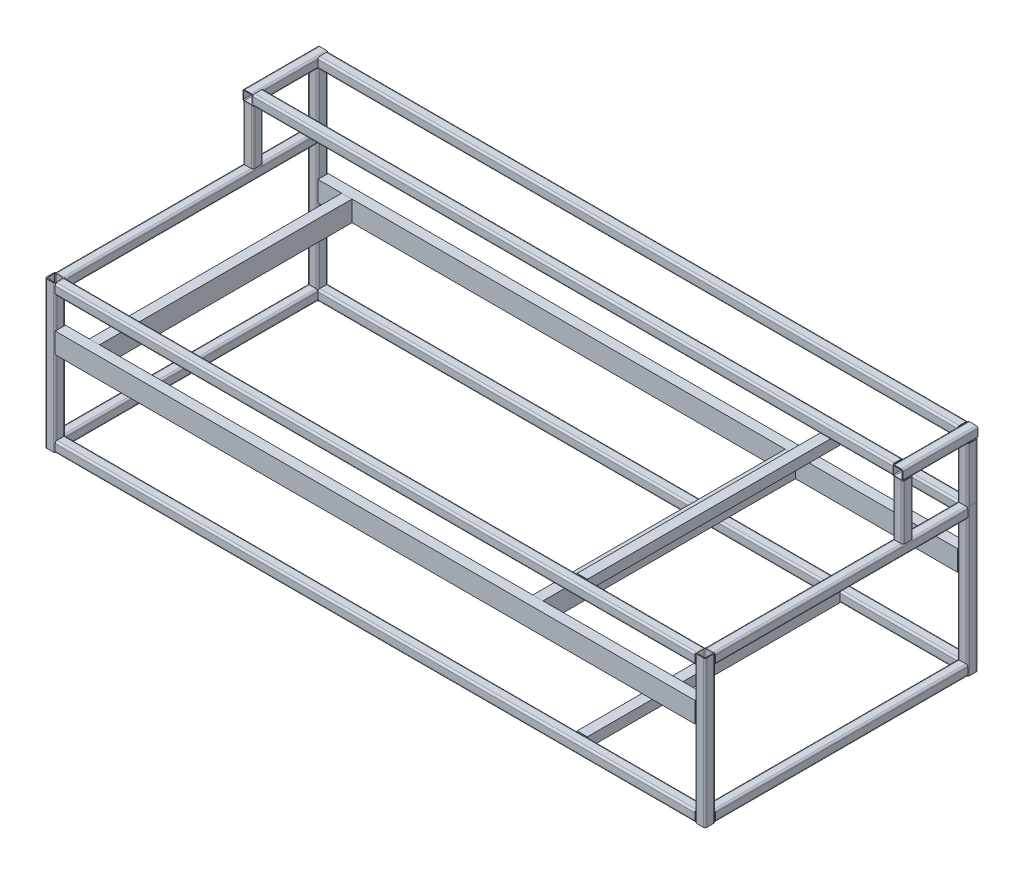
from build123d import *

# Parameters (mm, degrees)
STRUCTURAL_START                = 15
STRUCTURAL_MEMBER2_DEPTH        = 1875
STRUCTURAL_START_2              = -755
STRUCTURAL_MEMBER2_2_DEPTH      = 740
STRUCTURAL_START_3              = -15
STRUCTURAL_MEMBER2_3_DEPTH      = 430
BOSS_EXTRUDE1_REACH             = 1315.205
SKETCH2_W                       = 30
SKETCH2_H                       = 60
BOSS_EXTRUDE1_DIRECTION_2_REACH = 1315.205
BOSS_EXTRUDE2_START             = -30
SKETCH3_W                       = 30
SKETCH3_H                       = 60
BOSS_EXTRUDE2_DEPTH             = 740
BOSS_EXTRUDE2_2_DEPTH           = 740
BOSS_EXTRUDE3_DEPTH             = 160
BOSS_EXTRUDE3_2_DEPTH           = 160
LPATTERN1_COUNT                 = 2
LPATTERN1_PITCH                 = 190
STRUCTURAL_MEMBER3_DEPTH        = 1875
STRUCTURAL_START_4              = -785
STRUCTURAL_MEMBER3_2_DEPTH      = 220
SKETCH14_W                      = 30
SKETCH14_H                      = 30
BOSS_EXTRUDE4_DEPTH             = 740
BOSS_EXTRUDE4_2_DEPTH           = 740


# Read off the part's stored shape, not the designer's step: Structural Member2, Structural Member3
with BuildPart() as part:
    # Structural Member2 outline → Structural Member2 (new body)
    # profile 1 of 4: a face of its own
    with BuildSketch(Plane.YZ.offset(STRUCTURAL_START)):
        with BuildLine():
            Line((409.8, -755), (390.2, -755))
            ThreePointArc((390.2, -755), (386.523044738, -756.523044738), (385, -760.2))
            Line((385, -760.2), (385, -779.8))
            ThreePointArc((385, -779.8), (386.523044738, -783.476955262), (390.2, -785))
            Line((390.2, -785), (409.8, -785))
            ThreePointArc((409.8, -785), (413.476955262, -783.476955262), (415, -779.8))
            Line((415, -779.8), (415, -760.2))
            ThreePointArc((415, -760.2), (413.476955262, -756.523044738), (409.8, -755))
        make_face()
        with BuildLine():
            ThreePointArc((412.4, -779.8), (411.638477631, -781.638477631), (409.8, -782.4))
            Line((409.8, -782.4), (390.2, -782.4))
            ThreePointArc((390.2, -782.4), (388.361522369, -781.638477631), (387.6, -779.8))
            Line((387.6, -779.8), (387.6, -760.2))
            ThreePointArc((387.6, -760.2), (388.361522369, -758.361522369), (390.2, -757.6))
            Line((390.2, -757.6), (409.8, -757.6))
            ThreePointArc((409.8, -757.6), (411.638477631, -758.361522369), (412.4, -760.2))
            Line((412.4, -760.2), (412.4, -779.8))
        make_face(mode=Mode.SUBTRACT)
    # profile 2 of 4: a face of its own
    with BuildSketch(Plane.YZ.offset(STRUCTURAL_START)):
        with BuildLine():
            Line((409.8, 15), (390.2, 15))
            ThreePointArc((390.2, 15), (386.523044738, 13.476955262), (385, 9.8))
            Line((385, 9.8), (385, -9.8))
            ThreePointArc((385, -9.8), (386.523044738, -13.476955262), (390.2, -15))
            Line((390.2, -15), (409.8, -15))
            ThreePointArc((409.8, -15), (413.476955262, -13.476955262), (415, -9.8))
            Line((415, -9.8), (415, 9.8))
            ThreePointArc((415, 9.8), (413.476955262, 13.476955262), (409.8, 15))
        make_face()
        with BuildLine():
            ThreePointArc((412.4, -9.8), (411.638477631, -11.638477631), (409.8, -12.4))
            Line((409.8, -12.4), (390.2, -12.4))
            ThreePointArc((390.2, -12.4), (388.361522369, -11.638477631), (387.6, -9.8))
            Line((387.6, -9.8), (387.6, 9.8))
            ThreePointArc((387.6, 9.8), (388.361522369, 11.638477631), (390.2, 12.4))
            Line((390.2, 12.4), (409.8, 12.4))
            ThreePointArc((409.8, 12.4), (411.638477631, 11.638477631), (412.4, 9.8))
            Line((412.4, 9.8), (412.4, -9.8))
        make_face(mode=Mode.SUBTRACT)
    # profile 3 of 4: a face of its own
    with BuildSketch(Plane.YZ.offset(STRUCTURAL_START)):
        with BuildLine():
            Line((9.8, 15), (-9.8, 15))
            ThreePointArc((-9.8, 15), (-13.476955262, 13.476955262), (-15, 9.8))
            Line((-15, 9.8), (-15, -9.8))
            ThreePointArc((-15, -9.8), (-13.476955262, -13.476955262), (-9.8, -15))
            Line((-9.8, -15), (9.8, -15))
            ThreePointArc((9.8, -15), (13.476955262, -13.476955262), (15, -9.8))
            Line((15, -9.8), (15, 9.8))
            ThreePointArc((15, 9.8), (13.476955262, 13.476955262), (9.8, 15))
        make_face()
        with BuildLine():
            ThreePointArc((12.4, -9.8), (11.638477631, -11.638477631), (9.8, -12.4))
            Line((9.8, -12.4), (-9.8, -12.4))
            ThreePointArc((-9.8, -12.4), (-11.638477631, -11.638477631), (-12.4, -9.8))
            Line((-12.4, -9.8), (-12.4, 9.8))
            ThreePointArc((-12.4, 9.8), (-11.638477631, 11.638477631), (-9.8, 12.4))
            Line((-9.8, 12.4), (9.8, 12.4))
            ThreePointArc((9.8, 12.4), (11.638477631, 11.638477631), (12.4, 9.8))
            Line((12.4, 9.8), (12.4, -9.8))
        make_face(mode=Mode.SUBTRACT)
    # profile 4 of 4: a face of its own
    with BuildSketch(Plane.YZ.offset(STRUCTURAL_START)):
        with BuildLine():
            Line((9.8, -755), (-9.8, -755))
            ThreePointArc((-9.8, -755), (-13.476955262, -756.523044738), (-15, -760.2))
            Line((-15, -760.2), (-15, -779.8))
            ThreePointArc((-15, -779.8), (-13.476955262, -783.476955262), (-9.8, -785))
            Line((-9.8, -785), (9.8, -785))
            ThreePointArc((9.8, -785), (13.476955262, -783.476955262), (15, -779.8))
            Line((15, -779.8), (15, -760.2))
            ThreePointArc((15, -760.2), (13.476955262, -756.523044738), (9.8, -755))
        make_face()
        with BuildLine():
            ThreePointArc((12.4, -779.8), (11.638477631, -781.638477631), (9.8, -782.4))
            Line((9.8, -782.4), (-9.8, -782.4))
            ThreePointArc((-9.8, -782.4), (-11.638477631, -781.638477631), (-12.4, -779.8))
            Line((-12.4, -779.8), (-12.4, -760.2))
            ThreePointArc((-12.4, -760.2), (-11.638477631, -758.361522369), (-9.8, -757.6))
            Line((-9.8, -757.6), (9.8, -757.6))
            ThreePointArc((9.8, -757.6), (11.638477631, -758.361522369), (12.4, -760.2))
            Line((12.4, -760.2), (12.4, -779.8))
        make_face(mode=Mode.SUBTRACT)
    extrude(amount=STRUCTURAL_MEMBER2_DEPTH)


with BuildPart() as body_2:
    # Structural Member2 2 outline → Structural Member2 2 (new body)
    # profile 1 of 4: a face of its own
    with BuildSketch(Plane.XY.offset(STRUCTURAL_START_2)):
        with BuildLine():
            ThreePointArc((1920, 409.8), (1918.476955262, 413.476955262), (1914.8, 415))
            Line((1914.8, 415), (1895.2, 415))
            ThreePointArc((1895.2, 415), (1891.523044738, 413.476955262), (1890, 409.8))
            Line((1890, 409.8), (1890, 390.2))
            ThreePointArc((1890, 390.2), (1891.523044738, 386.523044738), (1895.2, 385))
            Line((1895.2, 385), (1914.8, 385))
            ThreePointArc((1914.8, 385), (1918.476955262, 386.523044738), (1920, 390.2))
            Line((1920, 390.2), (1920, 409.8))
        make_face()
        with BuildLine():
            Line((1892.6, 390.2), (1892.6, 409.8))
            ThreePointArc((1892.6, 409.8), (1893.361522369, 411.638477631), (1895.2, 412.4))
            Line((1895.2, 412.4), (1914.8, 412.4))
            ThreePointArc((1914.8, 412.4), (1916.638477631, 411.638477631), (1917.4, 409.8))
            Line((1917.4, 409.8), (1917.4, 390.2))
            ThreePointArc((1917.4, 390.2), (1916.638477631, 388.361522369), (1914.8, 387.6))
            Line((1914.8, 387.6), (1895.2, 387.6))
            ThreePointArc((1895.2, 387.6), (1893.361522369, 388.361522369), (1892.6, 390.2))
        make_face(mode=Mode.SUBTRACT)
    # profile 2 of 4: a face of its own
    with BuildSketch(Plane.XY.offset(STRUCTURAL_START_2)):
        with BuildLine():
            Line((1895.2, -15), (1914.8, -15))
            ThreePointArc((1914.8, -15), (1918.476955262, -13.476955262), (1920, -9.8))
            Line((1920, -9.8), (1920, 9.8))
            ThreePointArc((1920, 9.8), (1918.476955262, 13.476955262), (1914.8, 15))
            Line((1914.8, 15), (1895.2, 15))
            ThreePointArc((1895.2, 15), (1891.523044738, 13.476955262), (1890, 9.8))
            Line((1890, 9.8), (1890, -9.8))
            ThreePointArc((1890, -9.8), (1891.523044738, -13.476955262), (1895.2, -15))
        make_face()
        with BuildLine():
            ThreePointArc((1895.2, -12.4), (1893.361522369, -11.638477631), (1892.6, -9.8))
            Line((1892.6, -9.8), (1892.6, 9.8))
            ThreePointArc((1892.6, 9.8), (1893.361522369, 11.638477631), (1895.2, 12.4))
            Line((1895.2, 12.4), (1914.8, 12.4))
            ThreePointArc((1914.8, 12.4), (1916.638477631, 11.638477631), (1917.4, 9.8))
            Line((1917.4, 9.8), (1917.4, -9.8))
            ThreePointArc((1917.4, -9.8), (1916.638477631, -11.638477631), (1914.8, -12.4))
            Line((1914.8, -12.4), (1895.2, -12.4))
        make_face(mode=Mode.SUBTRACT)
    # profile 3 of 4: a face of its own
    with BuildSketch(Plane.XY.offset(STRUCTURAL_START_2)):
        with BuildLine():
            ThreePointArc((15, 409.8), (13.476955262, 413.476955262), (9.8, 415))
            Line((9.8, 415), (-9.8, 415))
            ThreePointArc((-9.8, 415), (-13.476955262, 413.476955262), (-15, 409.8))
            Line((-15, 409.8), (-15, 390.2))
            ThreePointArc((-15, 390.2), (-13.476955262, 386.523044738), (-9.8, 385))
            Line((-9.8, 385), (9.8, 385))
            ThreePointArc((9.8, 385), (13.476955262, 386.523044738), (15, 390.2))
            Line((15, 390.2), (15, 409.8))
        make_face()
        with BuildLine():
            Line((-12.4, 390.2), (-12.4, 409.8))
            ThreePointArc((-12.4, 409.8), (-11.638477631, 411.638477631), (-9.8, 412.4))
            Line((-9.8, 412.4), (9.8, 412.4))
            ThreePointArc((9.8, 412.4), (11.638477631, 411.638477631), (12.4, 409.8))
            Line((12.4, 409.8), (12.4, 390.2))
            ThreePointArc((12.4, 390.2), (11.638477631, 388.361522369), (9.8, 387.6))
            Line((9.8, 387.6), (-9.8, 387.6))
            ThreePointArc((-9.8, 387.6), (-11.638477631, 388.361522369), (-12.4, 390.2))
        make_face(mode=Mode.SUBTRACT)
    # profile 4 of 4: a face of its own
    with BuildSketch(Plane.XY.offset(STRUCTURAL_START_2)):
        with BuildLine():
            Line((-9.8, -15), (9.8, -15))
            ThreePointArc((9.8, -15), (13.476955262, -13.476955262), (15, -9.8))
            Line((15, -9.8), (15, 9.8))
            ThreePointArc((15, 9.8), (13.476955262, 13.476955262), (9.8, 15))
            Line((9.8, 15), (-9.8, 15))
            ThreePointArc((-9.8, 15), (-13.476955262, 13.476955262), (-15, 9.8))
            Line((-15, 9.8), (-15, -9.8))
            ThreePointArc((-15, -9.8), (-13.476955262, -13.476955262), (-9.8, -15))
        make_face()
        with BuildLine():
            ThreePointArc((-9.8, -12.4), (-11.638477631, -11.638477631), (-12.4, -9.8))
            Line((-12.4, -9.8), (-12.4, 9.8))
            ThreePointArc((-12.4, 9.8), (-11.638477631, 11.638477631), (-9.8, 12.4))
            Line((-9.8, 12.4), (9.8, 12.4))
            ThreePointArc((9.8, 12.4), (11.638477631, 11.638477631), (12.4, 9.8))
            Line((12.4, 9.8), (12.4, -9.8))
            ThreePointArc((12.4, -9.8), (11.638477631, -11.638477631), (9.8, -12.4))
            Line((9.8, -12.4), (-9.8, -12.4))
        make_face(mode=Mode.SUBTRACT)
    extrude(amount=STRUCTURAL_MEMBER2_2_DEPTH)


with BuildPart() as body_3:
    # Structural Member2 3 outline → Structural Member2 3 (new body)
    # profile 1 of 4: a face of its own
    with BuildSketch(Plane(origin=(0, 0, 0), x_dir=(1, 0, 0), z_dir=(0, 1, 0)).offset(STRUCTURAL_START_3)):
        with BuildLine():
            ThreePointArc((1920, 779.8), (1918.476955262, 783.476955262), (1914.8, 785))
            Line((1914.8, 785), (1895.2, 785))
            ThreePointArc((1895.2, 785), (1891.523044738, 783.476955262), (1890, 779.8))
            Line((1890, 779.8), (1890, 760.2))
            ThreePointArc((1890, 760.2), (1891.523044738, 756.523044738), (1895.2, 755))
            Line((1895.2, 755), (1914.8, 755))
            ThreePointArc((1914.8, 755), (1918.476955262, 756.523044738), (1920, 760.2))
            Line((1920, 760.2), (1920, 779.8))
        make_face()
        with BuildLine():
            Line((1892.6, 760.2), (1892.6, 779.8))
            ThreePointArc((1892.6, 779.8), (1893.361522369, 781.638477631), (1895.2, 782.4))
            Line((1895.2, 782.4), (1914.8, 782.4))
            ThreePointArc((1914.8, 782.4), (1916.638477631, 781.638477631), (1917.4, 779.8))
            Line((1917.4, 779.8), (1917.4, 760.2))
            ThreePointArc((1917.4, 760.2), (1916.638477631, 758.361522369), (1914.8, 757.6))
            Line((1914.8, 757.6), (1895.2, 757.6))
            ThreePointArc((1895.2, 757.6), (1893.361522369, 758.361522369), (1892.6, 760.2))
        make_face(mode=Mode.SUBTRACT)
    # profile 2 of 4: a face of its own
    with BuildSketch(Plane(origin=(0, 0, 0), x_dir=(1, 0, 0), z_dir=(0, 1, 0)).offset(STRUCTURAL_START_3)):
        with BuildLine():
            Line((1895.2, -15), (1914.8, -15))
            ThreePointArc((1914.8, -15), (1918.476955262, -13.476955262), (1920, -9.8))
            Line((1920, -9.8), (1920, 9.8))
            ThreePointArc((1920, 9.8), (1918.476955262, 13.476955262), (1914.8, 15))
            Line((1914.8, 15), (1895.2, 15))
            ThreePointArc((1895.2, 15), (1891.523044738, 13.476955262), (1890, 9.8))
            Line((1890, 9.8), (1890, -9.8))
            ThreePointArc((1890, -9.8), (1891.523044738, -13.476955262), (1895.2, -15))
        make_face()
        with BuildLine():
            ThreePointArc((1895.2, -12.4), (1893.361522369, -11.638477631), (1892.6, -9.8))
            Line((1892.6, -9.8), (1892.6, 9.8))
            ThreePointArc((1892.6, 9.8), (1893.361522369, 11.638477631), (1895.2, 12.4))
            Line((1895.2, 12.4), (1914.8, 12.4))
            ThreePointArc((1914.8, 12.4), (1916.638477631, 11.638477631), (1917.4, 9.8))
            Line((1917.4, 9.8), (1917.4, -9.8))
            ThreePointArc((1917.4, -9.8), (1916.638477631, -11.638477631), (1914.8, -12.4))
            Line((1914.8, -12.4), (1895.2, -12.4))
        make_face(mode=Mode.SUBTRACT)
    # profile 3 of 4: a face of its own
    with BuildSketch(Plane(origin=(0, 0, 0), x_dir=(1, 0, 0), z_dir=(0, 1, 0)).offset(STRUCTURAL_START_3)):
        with BuildLine():
            ThreePointArc((15, 779.8), (13.476955262, 783.476955262), (9.8, 785))
            Line((9.8, 785), (-9.8, 785))
            ThreePointArc((-9.8, 785), (-13.476955262, 783.476955262), (-15, 779.8))
            Line((-15, 779.8), (-15, 760.2))
            ThreePointArc((-15, 760.2), (-13.476955262, 756.523044738), (-9.8, 755))
            Line((-9.8, 755), (9.8, 755))
            ThreePointArc((9.8, 755), (13.476955262, 756.523044738), (15, 760.2))
            Line((15, 760.2), (15, 779.8))
        make_face()
        with BuildLine():
            Line((-12.4, 760.2), (-12.4, 779.8))
            ThreePointArc((-12.4, 779.8), (-11.638477631, 781.638477631), (-9.8, 782.4))
            Line((-9.8, 782.4), (9.8, 782.4))
            ThreePointArc((9.8, 782.4), (11.638477631, 781.638477631), (12.4, 779.8))
            Line((12.4, 779.8), (12.4, 760.2))
            ThreePointArc((12.4, 760.2), (11.638477631, 758.361522369), (9.8, 757.6))
            Line((9.8, 757.6), (-9.8, 757.6))
            ThreePointArc((-9.8, 757.6), (-11.638477631, 758.361522369), (-12.4, 760.2))
        make_face(mode=Mode.SUBTRACT)
    # profile 4 of 4: a face of its own
    with BuildSketch(Plane(origin=(0, 0, 0), x_dir=(1, 0, 0), z_dir=(0, 1, 0)).offset(STRUCTURAL_START_3)):
        with BuildLine():
            Line((-9.8, -15), (9.8, -15))
            ThreePointArc((9.8, -15), (13.476955262, -13.476955262), (15, -9.8))
            Line((15, -9.8), (15, 9.8))
            ThreePointArc((15, 9.8), (13.476955262, 13.476955262), (9.8, 15))
            Line((9.8, 15), (-9.8, 15))
            ThreePointArc((-9.8, 15), (-13.476955262, 13.476955262), (-15, 9.8))
            Line((-15, 9.8), (-15, -9.8))
            ThreePointArc((-15, -9.8), (-13.476955262, -13.476955262), (-9.8, -15))
        make_face()
        with BuildLine():
            ThreePointArc((-9.8, -12.4), (-11.638477631, -11.638477631), (-12.4, -9.8))
            Line((-12.4, -9.8), (-12.4, 9.8))
            ThreePointArc((-12.4, 9.8), (-11.638477631, 11.638477631), (-9.8, 12.4))
            Line((-9.8, 12.4), (9.8, 12.4))
            ThreePointArc((9.8, 12.4), (11.638477631, 11.638477631), (12.4, 9.8))
            Line((12.4, 9.8), (12.4, -9.8))
            ThreePointArc((12.4, -9.8), (11.638477631, -11.638477631), (9.8, -12.4))
            Line((9.8, -12.4), (-9.8, -12.4))
        make_face(mode=Mode.SUBTRACT)
    extrude(amount=STRUCTURAL_MEMBER2_3_DEPTH)


with BuildPart() as body_4:

    # Boss-Extrude1: up to this face of the body (flat: up to its plane)
    boss_extrude1_end = Plane(body_3.part.faces().sort_by_distance((15, 200, -770))[0])
    # Sketch2 → Boss-Extrude1 (new, up to the picked face)
    with BuildSketch(Plane(origin=(952.5, 0, 0), x_dir=(0, 0, -1), z_dir=(1, 0, 0)), mode=Mode.PRIVATE) as boss_extrude1_sk1:
        with Locations((770, 265)):
            Rectangle(SKETCH2_W, SKETCH2_H)
    boss_extrude1_tool1 = split(extrude(boss_extrude1_sk1.sketch, amount=-BOSS_EXTRUDE1_REACH, mode=Mode.PRIVATE), bisect_by=boss_extrude1_end, keep=Keep.BOTH, mode=Mode.PRIVATE)
    # Sketch2 → Boss-Extrude1 (new, up to the picked face)
    with BuildSketch(Plane(origin=(952.5, 0, 0), x_dir=(0, 0, -1), z_dir=(1, 0, 0)), mode=Mode.PRIVATE) as boss_extrude1_sk2:
        with Locations((0, 265)):
            Rectangle(SKETCH2_W, SKETCH2_H)
    boss_extrude1_tool2 = split(extrude(boss_extrude1_sk2.sketch, amount=-BOSS_EXTRUDE1_REACH, mode=Mode.PRIVATE), bisect_by=boss_extrude1_end, keep=Keep.BOTH, mode=Mode.PRIVATE)
    add(boss_extrude1_tool1.solids().sort_by(Axis((952.5, 265, -770), (-1, 0, 0)))[0])
    add(boss_extrude1_tool2.solids().sort_by(Axis((952.5, 265, 0), (-1, 0, 0)))[0])


    # Boss-Extrude1 direction 2: up to this face of the body (flat: up to its plane)
    boss_extrude1_direction_2_end = Plane(body_3.part.faces().sort_by_distance((1890, 200, -770))[0])
    # Sketch2 → Boss-Extrude1 direction 2 (add, up to the picked face)
    with BuildSketch(Plane(origin=(952.5, 0, 0), x_dir=(0, 0, -1), z_dir=(1, 0, 0)), mode=Mode.PRIVATE) as boss_extrude1_direction_2_sk1:
        with Locations((770, 265)):
            Rectangle(SKETCH2_W, SKETCH2_H)
    boss_extrude1_direction_2_tool1 = split(extrude(boss_extrude1_direction_2_sk1.sketch, amount=BOSS_EXTRUDE1_DIRECTION_2_REACH, mode=Mode.PRIVATE), bisect_by=boss_extrude1_direction_2_end, keep=Keep.BOTH, mode=Mode.PRIVATE)
    # Sketch2 → Boss-Extrude1 direction 2 (add, up to the picked face)
    with BuildSketch(Plane(origin=(952.5, 0, 0), x_dir=(0, 0, -1), z_dir=(1, 0, 0)), mode=Mode.PRIVATE) as boss_extrude1_direction_2_sk2:
        with Locations((0, 265)):
            Rectangle(SKETCH2_W, SKETCH2_H)
    boss_extrude1_direction_2_tool2 = split(extrude(boss_extrude1_direction_2_sk2.sketch, amount=BOSS_EXTRUDE1_DIRECTION_2_REACH, mode=Mode.PRIVATE), bisect_by=boss_extrude1_direction_2_end, keep=Keep.BOTH, mode=Mode.PRIVATE)
    add(boss_extrude1_direction_2_tool1.solids().sort_by(Axis((952.5, 265, -770), (1, 0, 0)))[0])
    add(boss_extrude1_direction_2_tool2.solids().sort_by(Axis((952.5, 265, 0), (1, 0, 0)))[0])


with BuildPart() as body_5:
    # Sketch3 → Boss-Extrude2 (new body)
    with BuildSketch(Plane.XY.offset(15).offset(BOSS_EXTRUDE2_START)):
        with Locations((100, 265)):
            Rectangle(SKETCH3_W, SKETCH3_H)
    extrude(amount=-BOSS_EXTRUDE2_DEPTH)


with BuildPart() as body_6:
    # Sketch3 → Boss-Extrude2 2 (new body)
    with BuildSketch(Plane.XY.offset(15).offset(BOSS_EXTRUDE2_START)):
        with Locations((1400, 265)):
            Rectangle(SKETCH3_W, SKETCH3_H)
    extrude(amount=-BOSS_EXTRUDE2_2_DEPTH)


with BuildPart() as body_7:
    # Sketch4 → Boss-Extrude3 (new body)
    with BuildSketch(Plane(origin=(0, 415, 0), x_dir=(1, 0, 0), z_dir=(0, 1, 0))):
        with BuildLine():
            Line((15, 760.2), (15, 779.8))
            ThreePointArc((15, 779.8), (13.476955262, 783.476955262), (9.8, 785))
            Line((9.8, 785), (-9.8, 785))
            ThreePointArc((-9.8, 785), (-13.476955262, 783.476955262), (-15, 779.8))
            Line((-15, 779.8), (-15, 760.2))
            ThreePointArc((-15, 760.2), (-13.476955262, 756.523044738), (-9.8, 755))
            Line((-9.8, 755), (9.8, 755))
            ThreePointArc((9.8, 755), (13.476955262, 756.523044738), (15, 760.2))
        make_face()
        with BuildLine():
            Line((-12.4, 779.8), (-12.4, 760.2))
            ThreePointArc((-12.4, 760.2), (-11.638477631, 758.361522369), (-9.8, 757.6))
            Line((-9.8, 757.6), (9.8, 757.6))
            ThreePointArc((9.8, 757.6), (11.638477631, 758.361522369), (12.4, 760.2))
            Line((12.4, 760.2), (12.4, 779.8))
            ThreePointArc((12.4, 779.8), (11.638477631, 781.638477631), (9.8, 782.4))
            Line((9.8, 782.4), (-9.8, 782.4))
            ThreePointArc((-9.8, 782.4), (-11.638477631, 781.638477631), (-12.4, 779.8))
        make_face(mode=Mode.SUBTRACT)
    boss_extrude3 = extrude(amount=BOSS_EXTRUDE3_DEPTH)


with BuildPart() as body_8:
    # Sketch4 → Boss-Extrude3 2 (new body)
    with BuildSketch(Plane(origin=(0, 415, 0), x_dir=(1, 0, 0), z_dir=(0, 1, 0))):
        with BuildLine():
            Line((1920, 760.2), (1920, 779.8))
            ThreePointArc((1920, 779.8), (1918.476955262, 783.476955262), (1914.8, 785))
            Line((1914.8, 785), (1895.2, 785))
            ThreePointArc((1895.2, 785), (1891.523044738, 783.476955262), (1890, 779.8))
            Line((1890, 779.8), (1890, 760.2))
            ThreePointArc((1890, 760.2), (1891.523044738, 756.523044738), (1895.2, 755))
            Line((1895.2, 755), (1914.8, 755))
            ThreePointArc((1914.8, 755), (1918.476955262, 756.523044738), (1920, 760.2))
        make_face()
        with BuildLine():
            Line((1914.8, 782.4), (1895.2, 782.4))
            ThreePointArc((1895.2, 782.4), (1893.361522369, 781.638477631), (1892.6, 779.8))
            Line((1892.6, 779.8), (1892.6, 760.2))
            ThreePointArc((1892.6, 760.2), (1893.361522369, 758.361522369), (1895.2, 757.6))
            Line((1895.2, 757.6), (1914.8, 757.6))
            ThreePointArc((1914.8, 757.6), (1916.638477631, 758.361522369), (1917.4, 760.2))
            Line((1917.4, 760.2), (1917.4, 779.8))
            ThreePointArc((1917.4, 779.8), (1916.638477631, 781.638477631), (1914.8, 782.4))
        make_face(mode=Mode.SUBTRACT)
    boss_extrude3_2 = extrude(amount=BOSS_EXTRUDE3_2_DEPTH)


with BuildPart() as body_2_1:
    add(body_2.part)

    # LPattern1: Boss-Extrude3, Boss-Extrude3 2 ×2
    with Locations(*[(0, 0, i * LPATTERN1_PITCH) for i in range(1, LPATTERN1_COUNT)]):
        add(boss_extrude3)
        add(boss_extrude3_2)


with BuildPart() as body_9:
    # Structural Member3 outline → Structural Member3 (new body)
    # profile 1 of 2: a face of its own
    with BuildSketch(Plane.YZ.offset(STRUCTURAL_START)):
        with BuildLine():
            Line((605, -779.8), (605, -760.2))
            ThreePointArc((605, -760.2), (603.476955262, -756.523044738), (599.8, -755))
            Line((599.8, -755), (580.2, -755))
            ThreePointArc((580.2, -755), (576.523044738, -756.523044738), (575, -760.2))
            Line((575, -760.2), (575, -779.8))
            ThreePointArc((575, -779.8), (576.523044738, -783.476955262), (580.2, -785))
            Line((580.2, -785), (599.8, -785))
            ThreePointArc((599.8, -785), (603.476955262, -783.476955262), (605, -779.8))
        make_face()
        with BuildLine():
            ThreePointArc((602.4, -779.8), (601.638477631, -781.638477631), (599.8, -782.4))
            Line((599.8, -782.4), (580.2, -782.4))
            ThreePointArc((580.2, -782.4), (578.361522369, -781.638477631), (577.6, -779.8))
            Line((577.6, -779.8), (577.6, -760.2))
            ThreePointArc((577.6, -760.2), (578.361522369, -758.361522369), (580.2, -757.6))
            Line((580.2, -757.6), (599.8, -757.6))
            ThreePointArc((599.8, -757.6), (601.638477631, -758.361522369), (602.4, -760.2))
            Line((602.4, -760.2), (602.4, -779.8))
        make_face(mode=Mode.SUBTRACT)
    # profile 2 of 2: a face of its own
    with BuildSketch(Plane.YZ.offset(STRUCTURAL_START)):
        with BuildLine():
            Line((605, -589.8), (605, -570.2))
            ThreePointArc((605, -570.2), (603.476955262, -566.523044738), (599.8, -565))
            Line((599.8, -565), (580.2, -565))
            ThreePointArc((580.2, -565), (576.523044738, -566.523044738), (575, -570.2))
            Line((575, -570.2), (575, -589.8))
            ThreePointArc((575, -589.8), (576.523044738, -593.476955262), (580.2, -595))
            Line((580.2, -595), (599.8, -595))
            ThreePointArc((599.8, -595), (603.476955262, -593.476955262), (605, -589.8))
        make_face()
        with BuildLine():
            ThreePointArc((599.8, -567.6), (601.638477631, -568.361522369), (602.4, -570.2))
            Line((602.4, -570.2), (602.4, -589.8))
            ThreePointArc((602.4, -589.8), (601.638477631, -591.638477631), (599.8, -592.4))
            Line((599.8, -592.4), (580.2, -592.4))
            ThreePointArc((580.2, -592.4), (578.361522369, -591.638477631), (577.6, -589.8))
            Line((577.6, -589.8), (577.6, -570.2))
            ThreePointArc((577.6, -570.2), (578.361522369, -568.361522369), (580.2, -567.6))
            Line((580.2, -567.6), (599.8, -567.6))
        make_face(mode=Mode.SUBTRACT)
    extrude(amount=STRUCTURAL_MEMBER3_DEPTH)


with BuildPart() as body_10:
    # Structural Member3 2 outline → Structural Member3 2 (new body)
    # profile 1 of 2: a face of its own
    with BuildSketch(Plane.XY.offset(STRUCTURAL_START_4)):
        with BuildLine():
            Line((1914.8, 605), (1895.2, 605))
            ThreePointArc((1895.2, 605), (1891.523044738, 603.476955262), (1890, 599.8))
            Line((1890, 599.8), (1890, 580.2))
            ThreePointArc((1890, 580.2), (1891.523044738, 576.523044738), (1895.2, 575))
            Line((1895.2, 575), (1914.8, 575))
            ThreePointArc((1914.8, 575), (1918.476955262, 576.523044738), (1920, 580.2))
            Line((1920, 580.2), (1920, 599.8))
            ThreePointArc((1920, 599.8), (1918.476955262, 603.476955262), (1914.8, 605))
        make_face()
        with BuildLine():
            ThreePointArc((1892.6, 599.8), (1893.361522369, 601.638477631), (1895.2, 602.4))
            Line((1895.2, 602.4), (1914.8, 602.4))
            ThreePointArc((1914.8, 602.4), (1916.638477631, 601.638477631), (1917.4, 599.8))
            Line((1917.4, 599.8), (1917.4, 580.2))
            ThreePointArc((1917.4, 580.2), (1916.638477631, 578.361522369), (1914.8, 577.6))
            Line((1914.8, 577.6), (1895.2, 577.6))
            ThreePointArc((1895.2, 577.6), (1893.361522369, 578.361522369), (1892.6, 580.2))
            Line((1892.6, 580.2), (1892.6, 599.8))
        make_face(mode=Mode.SUBTRACT)
    # profile 2 of 2: a face of its own
    with BuildSketch(Plane.XY.offset(STRUCTURAL_START_4)):
        with BuildLine():
            Line((9.8, 605), (-9.8, 605))
            ThreePointArc((-9.8, 605), (-13.476955262, 603.476955262), (-15, 599.8))
            Line((-15, 599.8), (-15, 580.2))
            ThreePointArc((-15, 580.2), (-13.476955262, 576.523044738), (-9.8, 575))
            Line((-9.8, 575), (9.8, 575))
            ThreePointArc((9.8, 575), (13.476955262, 576.523044738), (15, 580.2))
            Line((15, 580.2), (15, 599.8))
            ThreePointArc((15, 599.8), (13.476955262, 603.476955262), (9.8, 605))
        make_face()
        with BuildLine():
            ThreePointArc((-12.4, 599.8), (-11.638477631, 601.638477631), (-9.8, 602.4))
            Line((-9.8, 602.4), (9.8, 602.4))
            ThreePointArc((9.8, 602.4), (11.638477631, 601.638477631), (12.4, 599.8))
            Line((12.4, 599.8), (12.4, 580.2))
            ThreePointArc((12.4, 580.2), (11.638477631, 578.361522369), (9.8, 577.6))
            Line((9.8, 577.6), (-9.8, 577.6))
            ThreePointArc((-9.8, 577.6), (-11.638477631, 578.361522369), (-12.4, 580.2))
            Line((-12.4, 580.2), (-12.4, 599.8))
        make_face(mode=Mode.SUBTRACT)
    extrude(amount=STRUCTURAL_MEMBER3_2_DEPTH)


with BuildPart() as body_11:
    # Sketch14 → Boss-Extrude4 (new body)
    with BuildSketch(Plane.XY.offset(-755)):
        with Locations((1530, 400)):
            Rectangle(SKETCH14_W, SKETCH14_H)
    extrude(amount=BOSS_EXTRUDE4_DEPTH)


with BuildPart() as body_12:
    # Sketch14 → Boss-Extrude4 2 (new body)
    with BuildSketch(Plane.XY.offset(-755)):
        with Locations((1530, 0)):
            Rectangle(SKETCH14_W, SKETCH14_H)
    extrude(amount=BOSS_EXTRUDE4_2_DEPTH)


solid = Compound([part.part, body_3.part, body_4.part, body_5.part, body_6.part, body_7.part, body_8.part, body_2_1.part, body_9.part, body_10.part, body_11.part, body_12.part])
